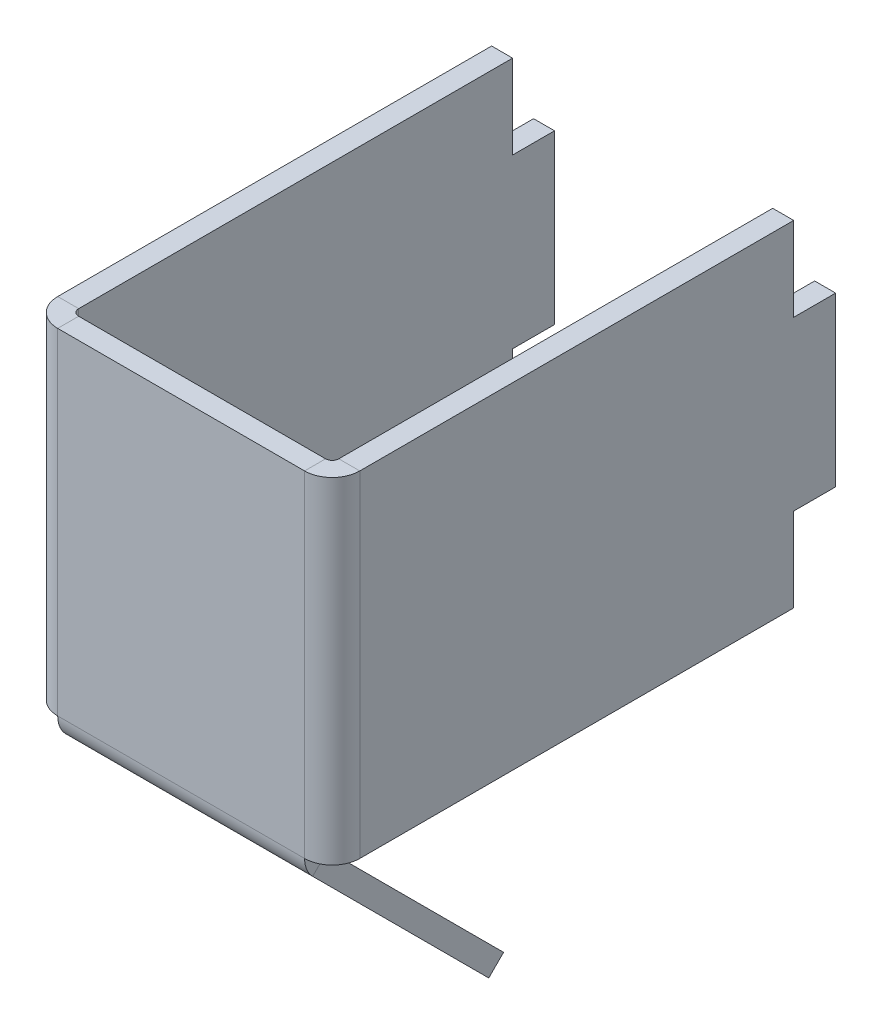
from build123d import *

# Parameters (mm, degrees)
BASE_FLANGE1_DEPTH  = 50.8
MITER_START         = -18.685
MITER_FLANGE2_DEPTH = 37.37
SKETCH24_W          = 6.35
SKETCH24_H          = 12.7
CUT_EXTRUDE1_DEPTH  = 3.175


# Read off the part's stored shape, not the designer's step: Miter Flange2
# Sheet-metal steps are written as plain solids
with BuildPart() as part:
    # Sketch1 → Base-Flange1 (new body)
    with BuildSketch(Plane(origin=(0, 0, 0), x_dir=(1, 0, 0), z_dir=(0, 1, 0))):
        with BuildLine():
            Line((-22.86, 76.2), (-22.86, 4.175))
            ThreePointArc((-22.86, 4.175), (-21.637170811, 1.222829189), (-18.685, 0))
            Line((-18.685, 0), (18.685, 0))
            ThreePointArc((18.685, 0), (21.637170811, 1.222829189), (22.86, 4.175))
            Line((22.86, 4.175), (22.86, 76.2))
            Line((22.86, 76.2), (19.685, 76.2))
            Line((19.685, 76.2), (19.685, 4.175))
            ThreePointArc((19.685, 4.175), (19.392106781, 3.467893219), (18.685, 3.175))
            Line((18.685, 3.175), (-18.685, 3.175))
            ThreePointArc((-18.685, 3.175), (-19.392106781, 3.467893219), (-19.685, 4.175))
            Line((-19.685, 4.175), (-19.685, 76.2))
            Line((-19.685, 76.2), (-22.86, 76.2))
        make_face()
    extrude(amount=BASE_FLANGE1_DEPTH)

    # Miter Flange2 outline → Miter Flange2 (add)
    with BuildSketch(Plane.YZ.offset(MITER_START)):
        with BuildLine():
            Line((-29.600045956, -27.870704333), (-27.354981926, -30.115768363))
            Line((-27.354981926, -30.115768363), (-0.707106781, -3.467893219))
            ThreePointArc((-0.707106781, -3.467893219), (-0.382683432, -3.251120467), (0, -3.175))
            Line((0, -3.175), (0, 0))
            ThreePointArc((0, 0), (-1.59770333, -0.317802952), (-2.952170811, -1.222829189))
            Line((-2.952170811, -1.222829189), (-29.600045956, -27.870704333))
        make_face()
    extrude(amount=MITER_FLANGE2_DEPTH)

    # Sketch24 → Cut-Extrude1 (cut)
    with BuildSketch(Plane.ZY.offset(22.86)):
        with Locations((-73.025, 44.45)):
            Rectangle(SKETCH24_W, SKETCH24_H)
        with Locations((-73.025, 6.35)):
            Rectangle(SKETCH24_W, SKETCH24_H)
    cut_extrude1 = extrude(amount=-CUT_EXTRUDE1_DEPTH, mode=Mode.SUBTRACT)

    # Mirror2: Cut-Extrude1 across plane
    add(cut_extrude1.mirror(Plane.ZY), mode=Mode.SUBTRACT)


solid = part.part
